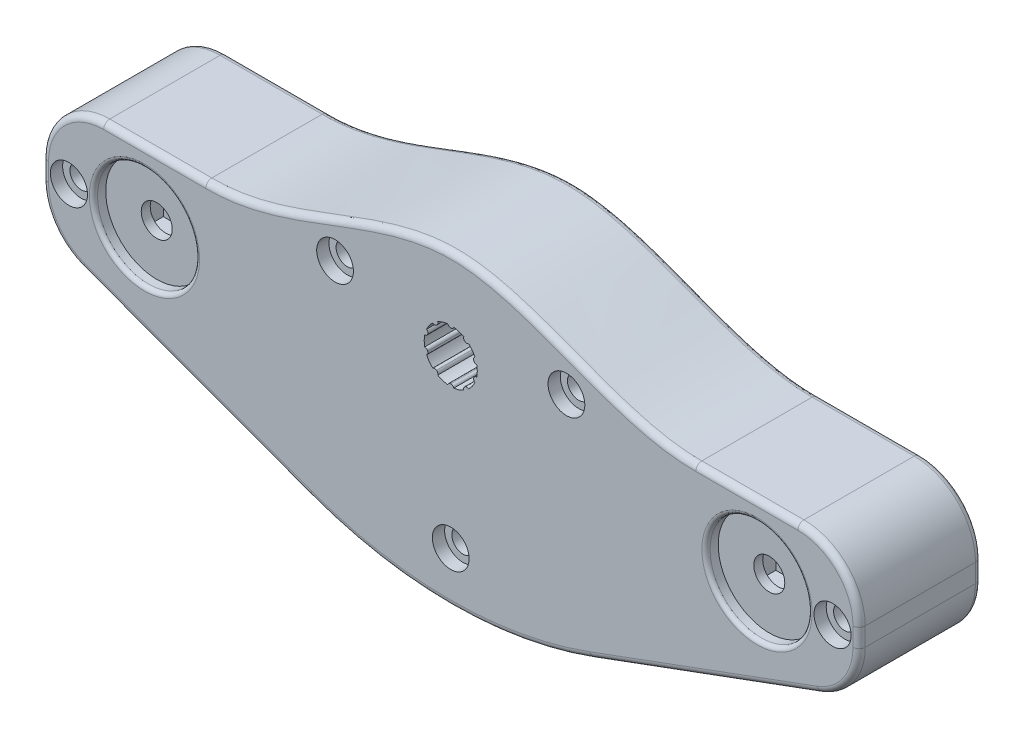
from build123d import *
from OCP.BRepFilletAPI import BRepFilletAPI_MakeChamfer

# Parameters (mm, degrees)
BOSS_EXTRUDE1_DEPTH           = 10
BOSS_EXTRUDE1_DEPTH_BACK      = 20
SKETCH12_R                    = 15
CUT_EXTRUDE9_DEPTH            = 8
CHAMFER1_SIZE                 = 1.5
CHAMFER1_SIZE2                = 0.46241
FILLET11_R                    = 0.78
CHAMFER2_SIZE2                = 5
CHAMFER2_SIZE                 = 8
CUT_EXTRUDE10_START           = -3
SKETCH18_W                    = 25.5
SKETCH18_H                    = 24.1
CUT_EXTRUDE10_DEPTH           = 4.1
SKETCH19_W                    = 8.6
SKETCH19_H                    = 8.6
CUT_EXTRUDE13_DEPTH           = 3.7
CUT_EXTRUDE14_DEPTH           = 2
SKETCH21_R                    = 3.8
CUT_EXTRUDE15_DEPTH           = 116.348128402
SKETCH10_R                    = 12.5
CUT_EXTRUDE8_DEPTH            = 3
SKETCH22_R                    = 0.95
BOSS_EXTRUDE5_DEPTH           = 1.1
BOSS_EXTRUDE5_DRAFT           = 30
BOSS_EXTRUDE5_PROFILE_2_DEPTH = 1.1
BOSS_EXTRUDE5_PROFILE_2_DRAFT = 30
BOSS_EXTRUDE5_PROFILE_3_DEPTH = 1.1
BOSS_EXTRUDE5_PROFILE_3_DRAFT = 30
BOSS_EXTRUDE5_PROFILE_4_DEPTH = 1.1
BOSS_EXTRUDE5_PROFILE_4_DRAFT = 30
CUT_EXTRUDE16_DEPTH           = 8.5
FILLET13_R                    = 2
BOSS_EXTRUDE6_DEPTH           = 3
LPATTERN1_COUNT               = 2
LPATTERN1_PITCH               = 150
LPATTERN1_COPY_1_SKETCH_R     = 0.95
LPATTERN1_COPY_1_DEPTH        = 1.1
LPATTERN1_COPY_1_DRAFT        = 30
LPATTERN1_COPY_2_SKETCH_R     = 0.95
LPATTERN1_COPY_2_DEPTH        = 1.1
LPATTERN1_COPY_2_DRAFT        = 30
LPATTERN1_COPY_3_SKETCH_R     = 0.95
LPATTERN1_COPY_3_DEPTH        = 1.1
LPATTERN1_COPY_3_DRAFT        = 30
LPATTERN1_COPY_4_SKETCH_R     = 0.95
LPATTERN1_COPY_4_DEPTH        = 1.1
LPATTERN1_COPY_4_DRAFT        = 30
LPATTERN1_COPY_5_SKETCH_R     = 0.95
LPATTERN1_COPY_5_DEPTH        = 1.1
LPATTERN1_COPY_5_DRAFT        = 30
LPATTERN1_COPY_6_SKETCH_R     = 0.95
LPATTERN1_COPY_6_DEPTH        = 1.1
LPATTERN1_COPY_6_DRAFT        = 30
LPATTERN1_COPY_7_SKETCH_R     = 0.95
LPATTERN1_COPY_7_DEPTH        = 1.1
LPATTERN1_COPY_7_DRAFT        = 30
FILLET13_OF_LPATTERN1_R       = 2
FILLET1_R                     = 15
FILLET12_R                    = 100
FILLET2_R                     = 1.5
FILLET14_R                    = 1
SKETCH32_R                    = 4.55
SKETCH32_R_2                  = 4.5
CUT_EXTRUDE17_DEPTH           = 3
SKETCH33_R                    = 2.75
CUT_EXTRUDE18_DEPTH           = 114.802213018
CUT_EXTRUDE19_DEPTH           = 5


# Some blends are built 0.0001 mm under size
with BuildPart() as part:
    # Sketch1 → Boss-Extrude1 (new, two sides: drawn at the far end of the back side and taken through both)
    with BuildSketch(Plane.XY.offset(-BOSS_EXTRUDE1_DEPTH_BACK)):
        with BuildLine():
            Line((-100, -15), (0, -51.866662613))
            Line((0, -51.866662613), (100, -15))
            Line((100, -15), (100, 15))
            Line((100, 15), (60, 15))
            add(Edge.make_bspline(
                [(-60, 15), (-39.699350007, 14.814430853), (0, 45.185569147), (39.699350007, 14.814430853), (60, 15)],
                knots=[0, 0, 0, 0, 0.5, 1, 1, 1, 1], degree=3))
            Line((-60, 15), (-100, 15))
            Line((-100, 15), (-100, -15))
        make_face()
        with BuildLine():
            Line((3.188323159, 2.335673435), (2.875864874, 2.765735369))
            Line((2.875864874, 2.765735369), (4.089390366, 3.647413248))
            Line((4.089390366, 3.647413248), (4.40184865, 3.217351313))
            ThreePointArc((4.40184865, 3.217351313), (5.258610463, 4.17939586), (5.908815238, 5.29151288))
            Line((5.908815238, 5.29151288), (5.403247113, 5.455781921))
            Line((5.403247113, 5.455781921), (5.866772605, 6.882366696))
            Line((5.866772605, 6.882366696), (6.37234073, 6.718097654))
            ThreePointArc((6.37234073, 6.718097654), (6.5, 8), (6.37234073, 9.281902346))
            Line((6.37234073, 9.281902346), (5.866772605, 9.117633304))
            Line((5.866772605, 9.117633304), (5.403247113, 10.544218079))
            Line((5.403247113, 10.544218079), (5.908815238, 10.70848712))
            ThreePointArc((5.908815238, 10.70848712), (5.258610463, 11.82060414), (4.40184865, 12.782648687))
            Line((4.40184865, 12.782648687), (4.089390366, 12.352586752))
            Line((4.089390366, 12.352586752), (2.875864874, 13.234264631))
            Line((2.875864874, 13.234264631), (3.188323159, 13.664326565))
            ThreePointArc((3.188323159, 13.664326565), (2.008610463, 14.181867356), (0.75, 14.456585785))
            Line((0.75, 14.456585785), (0.75, 13.925))
            Line((0.75, 13.925), (-0.75, 13.925))
            Line((-0.75, 13.925), (-0.75, 14.456585785))
            ThreePointArc((-0.75, 14.456585785), (-2.008610463, 14.181867356), (-3.188323159, 13.664326565))
            Line((-3.188323159, 13.664326565), (-2.875864874, 13.234264631))
            Line((-2.875864874, 13.234264631), (-4.089390366, 12.352586752))
            Line((-4.089390366, 12.352586752), (-4.40184865, 12.782648687))
            ThreePointArc((-4.40184865, 12.782648687), (-5.258610463, 11.82060414), (-5.908815238, 10.70848712))
            Line((-5.908815238, 10.70848712), (-5.403247113, 10.544218079))
            Line((-5.403247113, 10.544218079), (-5.866772605, 9.117633304))
            Line((-5.866772605, 9.117633304), (-6.37234073, 9.281902346))
            ThreePointArc((-6.37234073, 9.281902346), (-6.5, 8), (-6.37234073, 6.718097654))
            Line((-6.37234073, 6.718097654), (-5.866772605, 6.882366696))
            Line((-5.866772605, 6.882366696), (-5.403247113, 5.455781921))
            Line((-5.403247113, 5.455781921), (-5.908815238, 5.29151288))
            ThreePointArc((-5.908815238, 5.29151288), (-5.258610463, 4.17939586), (-4.40184865, 3.217351313))
            Line((-4.40184865, 3.217351313), (-4.089390366, 3.647413248))
            Line((-4.089390366, 3.647413248), (-2.875864874, 2.765735369))
            Line((-2.875864874, 2.765735369), (-3.188323159, 2.335673435))
            ThreePointArc((-3.188323159, 2.335673435), (-2.008610463, 1.818132644), (-0.75, 1.543414215))
            Line((-0.75, 1.543414215), (-0.75, 2.075))
            Line((-0.75, 2.075), (0.75, 2.075))
            Line((0.75, 2.075), (0.75, 1.543414215))
            ThreePointArc((0.75, 1.543414215), (2.008610463, 1.818132644), (3.188323159, 2.335673435))
        make_face(mode=Mode.SUBTRACT)
    extrude(amount=BOSS_EXTRUDE1_DEPTH + BOSS_EXTRUDE1_DEPTH_BACK)

    # Sketch12 → Cut-Extrude9 (cut)
    with BuildSketch(Plane(origin=(0, 0, -20), x_dir=(-1, 0, 0), z_dir=(0, 0, -1))):
        with Locations((0, 8)):
            Circle(SKETCH12_R)
    extrude(amount=-CUT_EXTRUDE9_DEPTH, mode=Mode.SUBTRACT)

    # Chamfer1: one chamfer whose edges measure the first distance from different faces: ONE call of the kernel's chamfer builder (chamfer() names one face for all edges)
    chamfer1_edges_1 = [part.edges().sort_by_distance(p)[0] for p in [
        (0, 2.075, -12),
    ]]
    chamfer1_side_1 = [part.faces().sort_by_distance(p)[0] for p in [
        (0, 2.075, -1),
    ]]
    chamfer1_edges_2 = [part.edges().sort_by_distance(p)[0] for p in [
        (3.48262762, 3.206574308, -12),
    ]]
    chamfer1_side_2 = [part.faces().sort_by_distance(p)[0] for p in [
        (3.48262762, 3.206574308, -1),
    ]]
    chamfer1_edges_3 = [part.edges().sort_by_distance(p)[0] for p in [
        (5.635009859, 6.169074308, -12),
    ]]
    chamfer1_side_3 = [part.faces().sort_by_distance(p)[0] for p in [
        (5.635009859, 6.169074308, -1),
    ]]
    chamfer1_edges_4 = [part.edges().sort_by_distance(p)[0] for p in [
        (5.635009859, 9.830925692, -12),
    ]]
    chamfer1_side_4 = [part.faces().sort_by_distance(p)[0] for p in [
        (5.635009859, 9.830925692, -1),
    ]]
    chamfer1_edges_5 = [part.edges().sort_by_distance(p)[0] for p in [
        (3.48262762, 12.793425692, -12),
    ]]
    chamfer1_side_5 = [part.faces().sort_by_distance(p)[0] for p in [
        (3.48262762, 12.793425692, -1),
    ]]
    chamfer1_edges_6 = [part.edges().sort_by_distance(p)[0] for p in [
        (0, 13.925, -12),
    ]]
    chamfer1_side_6 = [part.faces().sort_by_distance(p)[0] for p in [
        (0, 13.925, -1),
    ]]
    chamfer1_edges_7 = [part.edges().sort_by_distance(p)[0] for p in [
        (-3.48262762, 12.793425692, -12),
    ]]
    chamfer1_side_7 = [part.faces().sort_by_distance(p)[0] for p in [
        (-3.48262762, 12.793425692, -1),
    ]]
    chamfer1_edges_8 = [part.edges().sort_by_distance(p)[0] for p in [
        (-5.635009859, 9.830925692, -12),
    ]]
    chamfer1_side_8 = [part.faces().sort_by_distance(p)[0] for p in [
        (-5.635009859, 9.830925692, -1),
    ]]
    chamfer1_edges_9 = [part.edges().sort_by_distance(p)[0] for p in [
        (-5.635009859, 6.169074308, -12),
    ]]
    chamfer1_side_9 = [part.faces().sort_by_distance(p)[0] for p in [
        (-5.635009859, 6.169074308, -1),
    ]]
    chamfer1_edges_10 = [part.edges().sort_by_distance(p)[0] for p in [
        (-3.48262762, 3.206574308, -12),
    ]]
    chamfer1_side_10 = [part.faces().sort_by_distance(p)[0] for p in [
        (-3.48262762, 3.206574308, -1),
    ]]
    chamfer1 = BRepFilletAPI_MakeChamfer(part.part.solid().wrapped)
    for e in chamfer1_edges_1:
        chamfer1.Add(CHAMFER1_SIZE, CHAMFER1_SIZE2, e.wrapped, chamfer1_side_1[0].wrapped)  # the first distance lies on this face
    for e in chamfer1_edges_2:
        chamfer1.Add(CHAMFER1_SIZE, CHAMFER1_SIZE2, e.wrapped, chamfer1_side_2[0].wrapped)  # the first distance lies on this face
    for e in chamfer1_edges_3:
        chamfer1.Add(CHAMFER1_SIZE, CHAMFER1_SIZE2, e.wrapped, chamfer1_side_3[0].wrapped)  # the first distance lies on this face
    for e in chamfer1_edges_4:
        chamfer1.Add(CHAMFER1_SIZE, CHAMFER1_SIZE2, e.wrapped, chamfer1_side_4[0].wrapped)  # the first distance lies on this face
    for e in chamfer1_edges_5:
        chamfer1.Add(CHAMFER1_SIZE, CHAMFER1_SIZE2, e.wrapped, chamfer1_side_5[0].wrapped)  # the first distance lies on this face
    for e in chamfer1_edges_6:
        chamfer1.Add(CHAMFER1_SIZE, CHAMFER1_SIZE2, e.wrapped, chamfer1_side_6[0].wrapped)  # the first distance lies on this face
    for e in chamfer1_edges_7:
        chamfer1.Add(CHAMFER1_SIZE, CHAMFER1_SIZE2, e.wrapped, chamfer1_side_7[0].wrapped)  # the first distance lies on this face
    for e in chamfer1_edges_8:
        chamfer1.Add(CHAMFER1_SIZE, CHAMFER1_SIZE2, e.wrapped, chamfer1_side_8[0].wrapped)  # the first distance lies on this face
    for e in chamfer1_edges_9:
        chamfer1.Add(CHAMFER1_SIZE, CHAMFER1_SIZE2, e.wrapped, chamfer1_side_9[0].wrapped)  # the first distance lies on this face
    for e in chamfer1_edges_10:
        chamfer1.Add(CHAMFER1_SIZE, CHAMFER1_SIZE2, e.wrapped, chamfer1_side_10[0].wrapped)  # the first distance lies on this face
    add(Compound.cast(chamfer1.Shape()), mode=Mode.REPLACE)

    # Fillet11
    # the kernel refuses this fillet: 0.78 mm, written as the material it takes off along each edge
    with BuildSketch(Plane(origin=(-4.089390366, 12.352586752, -12.348462837), x_dir=(-0.5877852522924715, 0.8090169943749486, 0), z_dir=(0, 0, 1)), Plane(origin=(-5.866772605, 9.117633304, -12.348462837), x_dir=(-0.9510565162951549, 0.3090169943749433, 0), z_dir=(0, 0, 1)), Plane(origin=(-0.75, 13.925, -12.348462837), x_dir=(0, 1, 0), z_dir=(0, 0, 1)), Plane(origin=(2.875864874, 13.234264631, -12.348462837), x_dir=(0.587785252292472, 0.8090169943749482, 0), z_dir=(0, 0, 1)), Plane(origin=(5.403247113, 10.544218079, -12.348462837), x_dir=(0.9510565162951538, 0.30901699437494734, 0), z_dir=(0, 0, 1)), Plane(origin=(5.866772605, 6.882366696, -12.348462837), x_dir=(0.9510565162951544, -0.30901699437494534, 0), z_dir=(0, 0, 1)), Plane(origin=(-5.403247113, 5.455781921, -12.348462837), x_dir=(-0.9510565162951544, -0.30901699437494484, 0), z_dir=(0, 0, 1)), Plane(origin=(-2.875864874, 2.765735369, -12.348462837), x_dir=(-0.5877852522924728, -0.8090169943749477, 0), z_dir=(0, 0, 1)), Plane(origin=(0.75, 2.075, -12.348462837), x_dir=(0, -1, 0), z_dir=(0, 0, 1)), Plane(origin=(4.089390366, 3.647413248, -12.348462837), x_dir=(0.5877852522924725, -0.8090169943749479, 0), z_dir=(0, 0, 1))) as fillet11_piece_1:
        with BuildLine():
            CenterArc((0.78, -0.739385135), FILLET11_R, 108.571012268, 71.428987732)
            Line((0, -0.739385135), (-0.0156, -0.739385135))
            Line((-0.0156, -0.739385135), (-0.0156, 0))
            Line((-0.0156, 0), (0, 0.0156))
            ThreePointArc((0, 0.0156), (0.265792893, 0.0156), (0.526617501, 0.014787703))
            Line((0.526617501, 0.014787703), (0.531585785, 0))
        make_face()
    extrude(amount=24.196925675, mode=Mode.SUBTRACT)
    with BuildSketch(Plane(origin=(-5.403247113, 10.544218079, -12.348462837), x_dir=(-0.3090169943749473, -0.9510565162951535, 0), z_dir=(0, 0, 1)), Plane(origin=(-2.875864874, 13.234264631, -12.348462837), x_dir=(-0.8090169943749471, -0.5877852522924735, 0), z_dir=(0, 0, 1)), Plane(origin=(0.75, 13.925, -12.348462837), x_dir=(-1, 0, 0), z_dir=(0, 0, 1)), Plane(origin=(4.089390366, 12.352586752, -12.348462837), x_dir=(-0.8090169943749471, 0.5877852522924735, 0), z_dir=(0, 0, 1)), Plane(origin=(5.866772605, 9.117633304, -12.348462837), x_dir=(-0.30901699437494623, 0.951056516295154, 0), z_dir=(0, 0, 1)), Plane(origin=(5.403247113, 5.455781921, -12.348462837), x_dir=(0.30901699437494773, 0.9510565162951536, 0), z_dir=(0, 0, 1)), Plane(origin=(-5.866772605, 6.882366696, -12.348462837), x_dir=(0.3090169943749473, -0.9510565162951536, 0), z_dir=(0, 0, 1)), Plane(origin=(-4.089390366, 3.647413248, -12.348462837), x_dir=(0.809016994374947, -0.5877852522924737, 0), z_dir=(0, 0, 1)), Plane(origin=(-0.75, 2.075, -12.348462837), x_dir=(1, 0, 0), z_dir=(0, 0, 1)), Plane(origin=(2.875864874, 2.765735369, -12.348462837), x_dir=(0.8090169943749471, 0.5877852522924735, 0), z_dir=(0, 0, 1))) as fillet11_piece_2:
        with BuildLine():
            CenterArc((0.739385135, -0.78), FILLET11_R, 90, 71.428987732)
            Line((0, -0.531585785), (-0.014787703, -0.526617501))
            ThreePointArc((-0.014787703, -0.526617501), (-0.0156, -0.265792893), (-0.0156, 0))
            Line((-0.0156, 0), (0, 0.0156))
            Line((0, 0.0156), (0.739385135, 0.0156))
            Line((0.739385135, 0.0156), (0.739385135, 0))
        make_face()
    extrude(amount=24.196925675, mode=Mode.SUBTRACT)

    # Chamfer2
    chamfer2_edges = [part.edges().sort_by_distance(p)[0] for p in [
        (15, 8, -20),
    ]]
    chamfer2_side = [part.faces().sort_by_distance(p)[0] for p in [
        (15, 8, -19.9),
    ]]
    chamfer(chamfer2_edges, length=CHAMFER2_SIZE - 0.0001, length2=CHAMFER2_SIZE2 - 0.0001, reference=chamfer2_side[0])  # a hair under: the kernel refuses the full size

    # Sketch18 → Cut-Extrude10 (cut)
    with BuildSketch(Plane.XY.offset(CUT_EXTRUDE10_START)):
        with Locations((-75, 0.285)):
            Rectangle(SKETCH18_W, SKETCH18_H)
    cut_extrude10 = extrude(amount=CUT_EXTRUDE10_DEPTH, mode=Mode.SUBTRACT)

    # Sketch19 → Cut-Extrude13 (cut)
    with BuildSketch(Plane(origin=(0, 0, 1.1), x_dir=(-1, 0, 0), z_dir=(0, 0, -1))):
        with Locations((75, -2.265)):
            Rectangle(SKETCH19_W, SKETCH19_H)
    cut_extrude13 = extrude(amount=-CUT_EXTRUDE13_DEPTH, mode=Mode.SUBTRACT)

    # Sketch20 → Cut-Extrude14 (cut)
    with BuildSketch(Plane(origin=(0, 0, 1.1), x_dir=(-1, 0, 0), z_dir=(0, 0, -1))):
        Polygon((79.3, 2.035), (79.3, 5.335), (81.5, 5.335), (81.5, 9.835), (70.7, 9.835), (70.7, 2.035), align=None)
    cut_extrude14 = extrude(amount=-CUT_EXTRUDE14_DEPTH, mode=Mode.SUBTRACT)

    # Sketch21 → Cut-Extrude15 (cut, through all)
    with BuildSketch(Plane(origin=(0, 0, 4.8), x_dir=(-1, 0, 0), z_dir=(0, 0, -1))):
        with Locations((75, -2.265)):
            Circle(SKETCH21_R)
    cut_extrude15 = extrude(amount=-CUT_EXTRUDE15_DEPTH, mode=Mode.SUBTRACT)

    # Sketch10 → Cut-Extrude8 (cut)
    with BuildSketch(Plane.XY.offset(10)):
        with Locations((-75, -2.265)):
            Circle(SKETCH10_R)
    cut_extrude8 = extrude(amount=-CUT_EXTRUDE8_DEPTH, mode=Mode.SUBTRACT)


with BuildPart() as boss_extrude5_tool:
    # Sketch22 → Boss-Extrude5 (with draft: the straight prism first)
    with BuildSketch(Plane(origin=(0, 0, 1.1), x_dir=(-1, 0, 0), z_dir=(0, 0, -1))):
        with Locations((64.35, 10.235)):
            Circle(SKETCH22_R)
    extrude(amount=BOSS_EXTRUDE5_DEPTH)
    # Boss-Extrude5: the draft: its side faces are tilted about the plane it starts from
    boss_extrude5_sides = [boss_extrude5_tool.faces().sort_by_distance(p)[0] for p in [
        (-63.4, 10.235, 0.55),
    ]]
    draft(boss_extrude5_sides, Plane(origin=(0, 0, 1.1), x_dir=(-1, 0, 0), z_dir=(0, 0, -1)), BOSS_EXTRUDE5_DRAFT)


with BuildPart() as part_1:
    add(part.part)

    # Boss-Extrude5: add boss_extrude5_tool
    add(boss_extrude5_tool.part)


with BuildPart() as boss_extrude5_profile_2_tool:
    # Sketch22 → Boss-Extrude5 profile 2 (with draft: the straight prism first)
    with BuildSketch(Plane(origin=(0, 0, 1.1), x_dir=(-1, 0, 0), z_dir=(0, 0, -1))):
        with Locations((85.65, 10.235)):
            Circle(SKETCH22_R)
    extrude(amount=BOSS_EXTRUDE5_PROFILE_2_DEPTH)
    # Boss-Extrude5 profile 2: the draft: its side faces are tilted about the plane it starts from
    boss_extrude5_profile_2_sides = [boss_extrude5_profile_2_tool.faces().sort_by_distance(p)[0] for p in [
        (-84.7, 10.235, 0.55),
    ]]
    draft(boss_extrude5_profile_2_sides, Plane(origin=(0, 0, 1.1), x_dir=(-1, 0, 0), z_dir=(0, 0, -1)), BOSS_EXTRUDE5_PROFILE_2_DRAFT)


with BuildPart() as part_2:
    add(part_1.part)

    # Boss-Extrude5 profile 2: add boss_extrude5_profile_2_tool
    add(boss_extrude5_profile_2_tool.part)


with BuildPart() as boss_extrude5_profile_3_tool:
    # Sketch22 → Boss-Extrude5 profile 3 (with draft: the straight prism first)
    with BuildSketch(Plane(origin=(0, 0, 1.1), x_dir=(-1, 0, 0), z_dir=(0, 0, -1))):
        with Locations((85.65, -2.105)):
            Circle(SKETCH22_R)
    extrude(amount=BOSS_EXTRUDE5_PROFILE_3_DEPTH)
    # Boss-Extrude5 profile 3: the draft: its side faces are tilted about the plane it starts from
    boss_extrude5_profile_3_sides = [boss_extrude5_profile_3_tool.faces().sort_by_distance(p)[0] for p in [
        (-84.7, -2.105, 0.55),
    ]]
    draft(boss_extrude5_profile_3_sides, Plane(origin=(0, 0, 1.1), x_dir=(-1, 0, 0), z_dir=(0, 0, -1)), BOSS_EXTRUDE5_PROFILE_3_DRAFT)


with BuildPart() as part_3:
    add(part_2.part)

    # Boss-Extrude5 profile 3: add boss_extrude5_profile_3_tool
    add(boss_extrude5_profile_3_tool.part)


with BuildPart() as boss_extrude5_profile_4_tool:
    # Sketch22 → Boss-Extrude5 profile 4 (with draft: the straight prism first)
    with BuildSketch(Plane(origin=(0, 0, 1.1), x_dir=(-1, 0, 0), z_dir=(0, 0, -1))):
        with Locations((64.35, -2.105)):
            Circle(SKETCH22_R)
    extrude(amount=BOSS_EXTRUDE5_PROFILE_4_DEPTH)
    # Boss-Extrude5 profile 4: the draft: its side faces are tilted about the plane it starts from
    boss_extrude5_profile_4_sides = [boss_extrude5_profile_4_tool.faces().sort_by_distance(p)[0] for p in [
        (-63.4, -2.105, 0.55),
    ]]
    draft(boss_extrude5_profile_4_sides, Plane(origin=(0, 0, 1.1), x_dir=(-1, 0, 0), z_dir=(0, 0, -1)), BOSS_EXTRUDE5_PROFILE_4_DRAFT)


with BuildPart() as part_4:
    add(part_3.part)

    # Boss-Extrude5 profile 4: add boss_extrude5_profile_4_tool
    add(boss_extrude5_profile_4_tool.part)

    # Sketch24 → Cut-Extrude16 (cut, symmetric)
    with BuildSketch(Plane(origin=(-75, 0, 0), x_dir=(0, 0, -1), z_dir=(1, 0, 0))):
        Polygon((0.8, -11.765), (0.8, -19.265), (20, -19.265), (20, -18.065), (2, -18.065), (2, -11.765), align=None)
    cut_extrude16 = extrude(amount=CUT_EXTRUDE16_DEPTH, both=True, mode=Mode.SUBTRACT)

    # Fillet13
    fillet13_edges = [part_4.edges().sort_by_distance(p)[0] for p in [
        (-75, -19.265, -0.8),
        (-75, -18.065, -2),
    ]]
    fillet(fillet13_edges, radius=FILLET13_R)

    # Sketch25 → Boss-Extrude6 (add)
    with BuildSketch(Plane.XY.offset(-3)):
        with BuildLine():
            Line((-84.672341587, 10.739166667), (-83.303552478, 10.739166667))
            ThreePointArc((-83.303552478, 10.739166667), (-83.952943725, 8.537943725), (-86.154166667, 7.888552478))
            Line((-86.154166667, 7.888552478), (-86.154166667, 9.257341587))
            ThreePointArc((-86.154166667, 9.257341587), (-84.872182541, 9.457182541), (-84.672341587, 10.739166667))
        make_face()
        with BuildLine():
            Line((-65.327658413, 10.739166667), (-66.696447522, 10.739166667))
            ThreePointArc((-66.696447522, 10.739166667), (-66.047056275, 8.537943725), (-63.845833333, 7.888552478))
            Line((-63.845833333, 7.888552478), (-63.845833333, 9.257341587))
            ThreePointArc((-63.845833333, 9.257341587), (-65.127817459, 9.457182541), (-65.327658413, 10.739166667))
        make_face()
        with BuildLine():
            Line((-85.65, -1.005), (-85.65, 0.295))
            ThreePointArc((-85.65, 0.295), (-83.25, -2.105), (-85.65, -4.505))
            Line((-85.65, -4.505), (-85.65, -3.205))
            ThreePointArc((-85.65, -3.205), (-84.55, -2.105), (-85.65, -1.005))
        make_face()
        with BuildLine():
            Line((-64.35, -3.205), (-64.35, -4.505))
            ThreePointArc((-64.35, -4.505), (-66.75, -2.105), (-64.35, 0.295))
            Line((-64.35, 0.295), (-64.35, -1.005))
            ThreePointArc((-64.35, -1.005), (-65.45, -2.105), (-64.35, -3.205))
        make_face()
    boss_extrude6 = extrude(amount=BOSS_EXTRUDE6_DEPTH)

    # LPattern1: Cut-Extrude10, Cut-Extrude13, Cut-Extrude14, Cut-Extrude15, Cut-Extrude8, Cut-Extrude16, Boss-Extrude6 ×2
    with Locations(*[(i * LPATTERN1_PITCH, 0, 0) for i in range(1, LPATTERN1_COUNT)]):
        add(cut_extrude10, mode=Mode.SUBTRACT)
        add(cut_extrude13, mode=Mode.SUBTRACT)
        add(cut_extrude14, mode=Mode.SUBTRACT)
        add(cut_extrude15, mode=Mode.SUBTRACT)
        add(cut_extrude8, mode=Mode.SUBTRACT)
        add(cut_extrude16, mode=Mode.SUBTRACT)
        add(boss_extrude6)


with BuildPart() as lpattern1_copy_1_tool:
    # LPattern1 copy 1 sketch → LPattern1 copy 1 (with draft: the straight prism first)
    with BuildSketch(Plane(origin=(150, 0, 1.1), x_dir=(-1, 0, 0), z_dir=(0, 0, -1))):
        with Locations((64.35, 10.235)):
            Circle(LPATTERN1_COPY_1_SKETCH_R)
    extrude(amount=LPATTERN1_COPY_1_DEPTH)
    # LPattern1 copy 1: the draft: its side faces are tilted about the plane it starts from
    lpattern1_copy_1_sides = [lpattern1_copy_1_tool.faces().sort_by_distance(p)[0] for p in [
        (86.6, 10.235, 0.55),
    ]]
    draft(lpattern1_copy_1_sides, Plane(origin=(150, 0, 1.1), x_dir=(-1, 0, 0), z_dir=(0, 0, -1)), LPATTERN1_COPY_1_DRAFT)


with BuildPart() as part_5:
    add(part_4.part)

    # LPattern1 copy 1: add lpattern1_copy_1_tool
    add(lpattern1_copy_1_tool.part)


with BuildPart() as lpattern1_copy_2_tool:
    # LPattern1 copy 2 sketch → LPattern1 copy 2 (with draft: the straight prism first)
    with BuildSketch(Plane(origin=(150, 0, 1.1), x_dir=(-1, 0, 0), z_dir=(0, 0, -1))):
        with Locations((85.65, 10.235)):
            Circle(LPATTERN1_COPY_2_SKETCH_R)
    extrude(amount=LPATTERN1_COPY_2_DEPTH)
    # LPattern1 copy 2: the draft: its side faces are tilted about the plane it starts from
    lpattern1_copy_2_sides = [lpattern1_copy_2_tool.faces().sort_by_distance(p)[0] for p in [
        (65.3, 10.235, 0.55),
    ]]
    draft(lpattern1_copy_2_sides, Plane(origin=(150, 0, 1.1), x_dir=(-1, 0, 0), z_dir=(0, 0, -1)), LPATTERN1_COPY_2_DRAFT)


with BuildPart() as part_6:
    add(part_5.part)

    # LPattern1 copy 2: add lpattern1_copy_2_tool
    add(lpattern1_copy_2_tool.part)


with BuildPart() as lpattern1_copy_3_tool:
    # LPattern1 copy 3 sketch → LPattern1 copy 3 (with draft: the straight prism first)
    with BuildSketch(Plane(origin=(150, 0, 1.1), x_dir=(-1, 0, 0), z_dir=(0, 0, -1))):
        with Locations((85.65, -2.105)):
            Circle(LPATTERN1_COPY_3_SKETCH_R)
    extrude(amount=LPATTERN1_COPY_3_DEPTH)
    # LPattern1 copy 3: the draft: its side faces are tilted about the plane it starts from
    lpattern1_copy_3_sides = [lpattern1_copy_3_tool.faces().sort_by_distance(p)[0] for p in [
        (65.3, -2.105, 0.55),
    ]]
    draft(lpattern1_copy_3_sides, Plane(origin=(150, 0, 1.1), x_dir=(-1, 0, 0), z_dir=(0, 0, -1)), LPATTERN1_COPY_3_DRAFT)


with BuildPart() as part_7:
    add(part_6.part)

    # LPattern1 copy 3: add lpattern1_copy_3_tool
    add(lpattern1_copy_3_tool.part)


with BuildPart() as lpattern1_copy_4_tool:
    # LPattern1 copy 4 sketch → LPattern1 copy 4 (with draft: the straight prism first)
    with BuildSketch(Plane(origin=(150, 0, 1.1), x_dir=(-1, 0, 0), z_dir=(0, 0, -1))):
        with Locations((64.35, -2.105)):
            Circle(LPATTERN1_COPY_4_SKETCH_R)
    extrude(amount=LPATTERN1_COPY_4_DEPTH)
    # LPattern1 copy 4: the draft: its side faces are tilted about the plane it starts from
    lpattern1_copy_4_sides = [lpattern1_copy_4_tool.faces().sort_by_distance(p)[0] for p in [
        (86.6, -2.105, 0.55),
    ]]
    draft(lpattern1_copy_4_sides, Plane(origin=(150, 0, 1.1), x_dir=(-1, 0, 0), z_dir=(0, 0, -1)), LPATTERN1_COPY_4_DRAFT)


with BuildPart() as part_8:
    add(part_7.part)

    # LPattern1 copy 4: add lpattern1_copy_4_tool
    add(lpattern1_copy_4_tool.part)


with BuildPart() as lpattern1_copy_5_tool:
    # LPattern1 copy 5 sketch → LPattern1 copy 5 (with draft: the straight prism first)
    with BuildSketch(Plane(origin=(150, 0, 1.1), x_dir=(-1, 0, 0), z_dir=(0, 0, -1))):
        with Locations((85.65, 10.235)):
            Circle(LPATTERN1_COPY_5_SKETCH_R)
    extrude(amount=LPATTERN1_COPY_5_DEPTH)
    # LPattern1 copy 5: the draft: its side faces are tilted about the plane it starts from
    lpattern1_copy_5_sides = [lpattern1_copy_5_tool.faces().sort_by_distance(p)[0] for p in [
        (65.3, 10.235, 0.55),
    ]]
    draft(lpattern1_copy_5_sides, Plane(origin=(150, 0, 1.1), x_dir=(-1, 0, 0), z_dir=(0, 0, -1)), LPATTERN1_COPY_5_DRAFT)


with BuildPart() as part_9:
    add(part_8.part)

    # LPattern1 copy 5: add lpattern1_copy_5_tool
    add(lpattern1_copy_5_tool.part)


with BuildPart() as lpattern1_copy_6_tool:
    # LPattern1 copy 6 sketch → LPattern1 copy 6 (with draft: the straight prism first)
    with BuildSketch(Plane(origin=(150, 0, 1.1), x_dir=(-1, 0, 0), z_dir=(0, 0, -1))):
        with Locations((85.65, -2.105)):
            Circle(LPATTERN1_COPY_6_SKETCH_R)
    extrude(amount=LPATTERN1_COPY_6_DEPTH)
    # LPattern1 copy 6: the draft: its side faces are tilted about the plane it starts from
    lpattern1_copy_6_sides = [lpattern1_copy_6_tool.faces().sort_by_distance(p)[0] for p in [
        (65.3, -2.105, 0.55),
    ]]
    draft(lpattern1_copy_6_sides, Plane(origin=(150, 0, 1.1), x_dir=(-1, 0, 0), z_dir=(0, 0, -1)), LPATTERN1_COPY_6_DRAFT)


with BuildPart() as part_10:
    add(part_9.part)

    # LPattern1 copy 6: add lpattern1_copy_6_tool
    add(lpattern1_copy_6_tool.part)


with BuildPart() as lpattern1_copy_7_tool:
    # LPattern1 copy 7 sketch → LPattern1 copy 7 (with draft: the straight prism first)
    with BuildSketch(Plane(origin=(150, 0, 1.1), x_dir=(-1, 0, 0), z_dir=(0, 0, -1))):
        with Locations((64.35, -2.105)):
            Circle(LPATTERN1_COPY_7_SKETCH_R)
    extrude(amount=LPATTERN1_COPY_7_DEPTH)
    # LPattern1 copy 7: the draft: its side faces are tilted about the plane it starts from
    lpattern1_copy_7_sides = [lpattern1_copy_7_tool.faces().sort_by_distance(p)[0] for p in [
        (86.6, -2.105, 0.55),
    ]]
    draft(lpattern1_copy_7_sides, Plane(origin=(150, 0, 1.1), x_dir=(-1, 0, 0), z_dir=(0, 0, -1)), LPATTERN1_COPY_7_DRAFT)


with BuildPart() as part_11:
    add(part_10.part)

    # LPattern1 copy 7: add lpattern1_copy_7_tool
    add(lpattern1_copy_7_tool.part)

    # Fillet13 of LPattern1
    fillet13_of_lpattern1_edges = [part_11.edges().sort_by_distance(p)[0] for p in [
        (75, -19.265, -0.8),
        (75, -18.065, -2),
    ]]
    fillet(fillet13_of_lpattern1_edges, radius=FILLET13_OF_LPATTERN1_R)

    # Fillet1
    fillet1_edges = [part_11.edges().sort_by_distance(p)[0] for p in [
        (-100, -15, -5),
        (-100, 15, -5),
        (100, 15, -5),
        (100, -15, -5),
    ]]
    fillet(fillet1_edges, radius=FILLET1_R)

    # Fillet12
    fillet12_edges = [part_11.edges().sort_by_distance(p)[0] for p in [
        (0, -51.866662613, -5),
    ]]
    fillet(fillet12_edges, radius=FILLET12_R)

    # Fillet2
    fillet2_edges = [part_11.edges().sort_by_distance(p)[0] for p in [
        (-72.5, 15, 10),
        (-72.5, 15, -20),
        (100, -2.271550921, 10),
        (100, -2.271550921, -20),
        (72.5, 15, 10),
        (-100, -2.271550921, 10),
        (-62.389723071, -28.865653903, 10),
        (-97.305067069, -13.12129072, 10),
        (97.305067069, -13.12129072, 10),
        (-95.606601718, 10.606601718, 10),
        (95.606601718, 10.606601718, 10),
        (72.5, 15, -20),
        (-62.389723071, -28.865653903, -20),
        (-100, -2.271550921, -20),
        (-97.305067069, -13.12129072, -20),
        (97.305067069, -13.12129072, -20),
        (-95.606601718, 10.606601718, -20),
        (95.606601718, 10.606601718, -20),
        (62.389723071, -28.865653903, 10),
        (0, -45.287345613, 10),
        (62.389723071, -28.865653903, -20),
        (0, -45.287345613, -20),
    ]]
    fillet(fillet2_edges, radius=FILLET2_R)

    # Fillet14
    fillet14_edges = [part_11.edges().sort_by_distance(p)[0] for p in [
        (19.9999, 8, -20),
        (-87.5, -2.265, 10),
        (62.5, -2.265, 10),
    ]]
    fillet(fillet14_edges, radius=FILLET14_R)

    # Sketch32 → Cut-Extrude17 (cut)
    with BuildSketch(Plane.XY.offset(10)):
        with Locations((-93.5, -2.271550921)):
            Circle(SKETCH32_R)
        with Locations((-28.332209431, 14.008347309)):
            Circle(SKETCH32_R_2)
        with Locations((0, -32.79283808)):
            Circle(SKETCH32_R_2)
    cut_extrude17 = extrude(amount=-CUT_EXTRUDE17_DEPTH, mode=Mode.SUBTRACT)

    # Sketch33 → Cut-Extrude18 (cut, through all)
    with BuildSketch(Plane.XY.offset(10)):
        with Locations((-28.332209431, 14.008347309)):
            Circle(SKETCH33_R)
        with Locations((-93.5, -2.271550921)):
            Circle(SKETCH33_R)
        with Locations((0, -32.79283808)):
            Circle(SKETCH33_R)
    cut_extrude18 = extrude(amount=-CUT_EXTRUDE18_DEPTH, mode=Mode.SUBTRACT)

    # Sketch35 → Cut-Extrude19 (cut)
    with BuildSketch(Plane(origin=(0, 0, -20), x_dir=(-1, 0, 0), z_dir=(0, 0, -1))):
        Polygon((4.55, -30.165894355), (0, -27.53895063), (-4.55, -30.165894355), (-4.55, -35.419781805), (0, -38.04672553), (4.55, -35.419781805), align=None)
        Polygon((32.882209431, 16.635291034), (28.332209431, 19.262234759), (23.782209431, 16.635291034), (23.782209431, 11.381403584), (28.332209431, 8.75445986), (32.882209431, 11.381403584), align=None)
        Polygon((98.05, 0.355392804), (93.5, 2.982336529), (88.95, 0.355392804), (88.95, -4.898494646), (93.5, -7.525438371), (98.05, -4.898494646), align=None)
    cut_extrude19 = extrude(amount=-CUT_EXTRUDE19_DEPTH, mode=Mode.SUBTRACT)

    # Mirror1: Cut-Extrude17, Cut-Extrude18, Cut-Extrude19 across plane
    add(cut_extrude17.mirror(Plane(origin=(0, 0, 0), x_dir=(0, 0, 1), z_dir=(1, 0, 0))), mode=Mode.SUBTRACT)
    add(cut_extrude18.mirror(Plane(origin=(0, 0, 0), x_dir=(0, 0, 1), z_dir=(1, 0, 0))), mode=Mode.SUBTRACT)
    add(cut_extrude19.mirror(Plane(origin=(0, 0, 0), x_dir=(0, 0, 1), z_dir=(1, 0, 0))), mode=Mode.SUBTRACT)


solid = part_11.part
